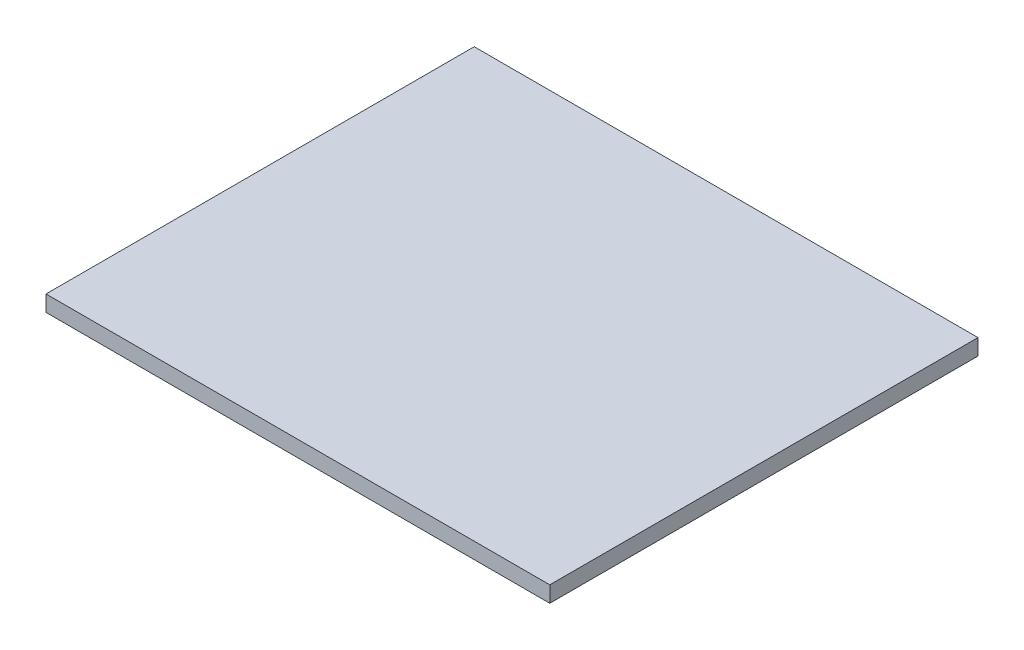
from build123d import *

# Parameters (mm, degrees)
SKETCH1_W               = 200
SKETCH1_H               = 170
F_1_4_STEEL_PLATE_DEPTH = 6.35


with BuildPart() as part:
    # Sketch1 → 1/4" Steel Plate (new body)
    with BuildSketch(Plane(origin=(0, 0, 0), x_dir=(1, 0, 0), z_dir=(0, 1, 0))):
        Rectangle(SKETCH1_W, SKETCH1_H)
    extrude(amount=F_1_4_STEEL_PLATE_DEPTH)


solid = part.part
